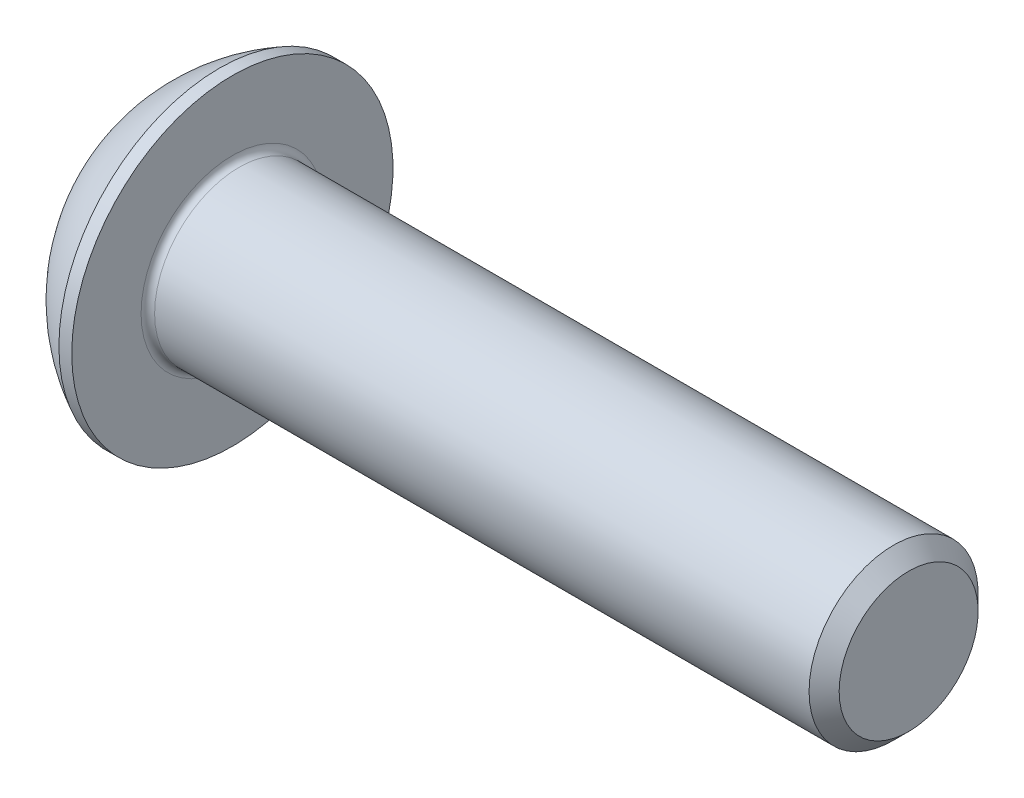
from build123d import *

# Parameters (mm, degrees)
FILLET1_R   = 0.2
HEX_2_DEPTH = 1.56


with BuildPart() as part:
    # BodySke → BaseBody (revolve)
    with BuildSketch(Plane.XY):
        with BuildLine():
            Line((22.75, 0), (22.75, 2.055))
            Line((22.75, 2.055), (22.305, 2.5))
            Line((22.305, 2.5), (2.75, 2.5))
            Line((2.75, 2.5), (2.75, 4.75))
            Line((2.75, 4.75), (2.37, 4.75))
            ThreePointArc((2.37, 4.75), (0.992680215, 3.754414901), (0, 2.375))
            Line((0, 2.375), (0, 0))
            Line((0, 0), (22.75, 0))
        make_face()
    revolve(axis=Axis((0, 0, 0), (1, 0, 0)))

    # Fillet1
    fillet1_edges = [part.edges().sort_by_distance(p)[0] for p in [
        (2.75, -2.5, 0),
    ]]
    fillet(fillet1_edges, radius=FILLET1_R)

    # Sketch2 → PreBroach (revolve, cut)
    with BuildSketch(Plane.XY):
        Polygon((0, 1.5), (1.56, 1.5), (2.426025404, 0), (0, 0), align=None)
    revolve(axis=Axis((0, 0, 0), (1, 0, 0)), mode=Mode.SUBTRACT)

    # Sketch3 → Hex 2 (cut)
    with BuildSketch(Plane(origin=(0, 0, 0), x_dir=(0, 0, -1), z_dir=(1, 0, 0))):
        Polygon((-1.5, -0.866025404), (-1.5, 0.866025404), (0, 1.732050808), (1.5, 0.866025404), (1.5, -0.866025404), (0, -1.732050808), align=None)
    extrude(amount=HEX_2_DEPTH, mode=Mode.SUBTRACT)


solid = part.part
